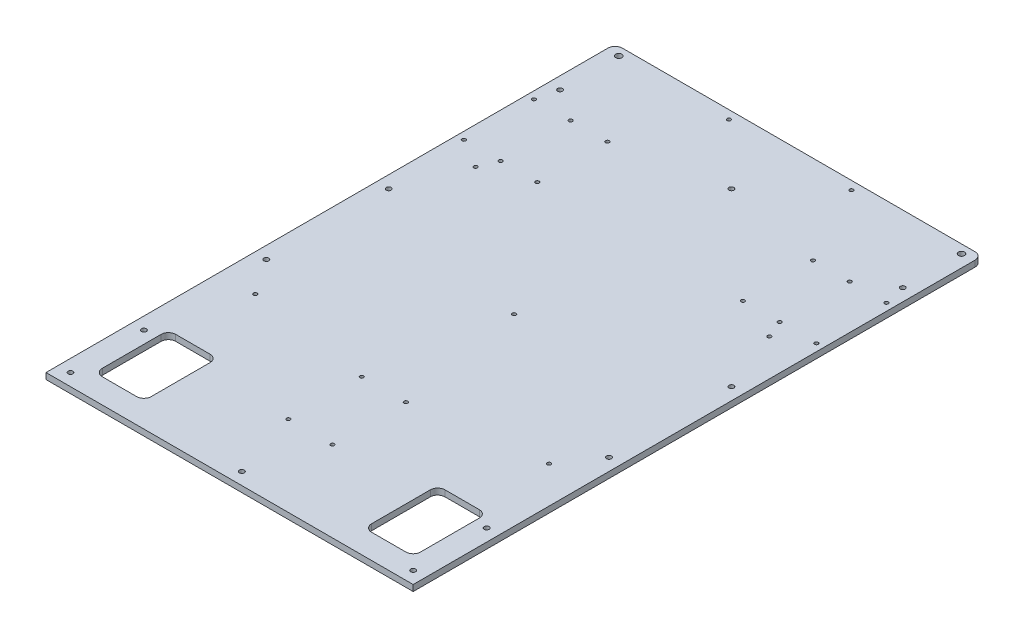
from build123d import *

# Parameters (mm, degrees)
SKETCH1_R           = 2
SKETCH1_W           = 40
SKETCH1_H           = 60
SKETCH1_R_2         = 1.5
SKETCH1_R_3         = 2.5
BOSS_EXTRUDE1_DEPTH = 5
FILLET1_R           = 6
SKETCH2_R           = 1.5
CUT_EXTRUDE1_DEPTH  = 296.88849251


with BuildPart() as part:
    # Sketch1 → Boss-Extrude1 (new body)
    with BuildSketch(Plane(origin=(0, 0, 0), x_dir=(1, 0, 0), z_dir=(0, 1, 0))):
        Polygon((-150, 210), (-150, -210), (150, -210), (150, 210), (150, 255), (-150, 255), align=None)
        with Locations((-140, -200)):
            Circle(SKETCH1_R, mode=Mode.SUBTRACT)
        with Locations((-110, -160)):
            Rectangle(SKETCH1_W, SKETCH1_H, mode=Mode.SUBTRACT)
        with Locations((-140, -140)):
            Circle(SKETCH1_R, mode=Mode.SUBTRACT)
        with Locations((-140, -40)):
            Circle(SKETCH1_R, mode=Mode.SUBTRACT)
        with Locations((0, -200)):
            Circle(SKETCH1_R, mode=Mode.SUBTRACT)
        with Locations((110, -160)):
            Rectangle(SKETCH1_W, SKETCH1_H, mode=Mode.SUBTRACT)
        with Locations((140, -200)):
            Circle(SKETCH1_R, mode=Mode.SUBTRACT)
        with Locations((140, -140)):
            Circle(SKETCH1_R, mode=Mode.SUBTRACT)
        with Locations((140, -40)):
            Circle(SKETCH1_R, mode=Mode.SUBTRACT)
        with Locations((-140, 60)):
            Circle(SKETCH1_R, mode=Mode.SUBTRACT)
        with Locations((-144, 125.375)):
            Circle(SKETCH1_R_2, mode=Mode.SUBTRACT)
        with Locations((-114, 125.375)):
            Circle(SKETCH1_R_2, mode=Mode.SUBTRACT)
        with Locations((-84, 125.375)):
            Circle(SKETCH1_R_2, mode=Mode.SUBTRACT)
        with Locations((-144, 182.625)):
            Circle(SKETCH1_R_2, mode=Mode.SUBTRACT)
        with Locations((-114, 182.625)):
            Circle(SKETCH1_R_2, mode=Mode.SUBTRACT)
        with Locations((-84, 182.625)):
            Circle(SKETCH1_R_2, mode=Mode.SUBTRACT)
        with Locations((-140, 200)):
            Circle(SKETCH1_R, mode=Mode.SUBTRACT)
        with Locations((-140, 248)):
            Circle(SKETCH1_R_3, mode=Mode.SUBTRACT)
        with Locations((-50, 248)):
            Circle(SKETCH1_R_2, mode=Mode.SUBTRACT)
        with Locations((140, 60)):
            Circle(SKETCH1_R, mode=Mode.SUBTRACT)
        with Locations((84, 125.375)):
            Circle(SKETCH1_R_2, mode=Mode.SUBTRACT)
        with Locations((114, 125.375)):
            Circle(SKETCH1_R_2, mode=Mode.SUBTRACT)
        with Locations((144, 125.375)):
            Circle(SKETCH1_R_2, mode=Mode.SUBTRACT)
        with Locations((0, 200)):
            Circle(SKETCH1_R, mode=Mode.SUBTRACT)
        with Locations((50, 248)):
            Circle(SKETCH1_R_2, mode=Mode.SUBTRACT)
        with Locations((84, 182.625)):
            Circle(SKETCH1_R_2, mode=Mode.SUBTRACT)
        with Locations((114, 182.625)):
            Circle(SKETCH1_R_2, mode=Mode.SUBTRACT)
        with Locations((144, 182.625)):
            Circle(SKETCH1_R_2, mode=Mode.SUBTRACT)
        with Locations((140, 200)):
            Circle(SKETCH1_R, mode=Mode.SUBTRACT)
        with Locations((140, 248)):
            Circle(SKETCH1_R_3, mode=Mode.SUBTRACT)
    extrude(amount=BOSS_EXTRUDE1_DEPTH)

    # Fillet1
    fillet1_edges = [part.edges().sort_by_distance(p)[0] for p in [
        (-130, 2.5, 130),
        (150, 2.5, -255),
        (-150, 2.5, -255),
        (130, 2.5, 190),
        (130, 2.5, 130),
        (90, 2.5, 130),
        (90, 2.5, 190),
        (-130, 2.5, 190),
        (-90, 2.5, 190),
        (-90, 2.5, 130),
    ]]
    fillet(fillet1_edges, radius=FILLET1_R)

    # Sketch2 → Cut-Extrude1 (cut, through all)
    with BuildSketch(Plane(origin=(0, 5, 0), x_dir=(1, 0, 0), z_dir=(0, 1, 0))):
        with Locations((-18, -144)):
            Circle(SKETCH2_R)
        with Locations((18, -144)):
            Circle(SKETCH2_R)
        with Locations((18, -84)):
            Circle(SKETCH2_R)
        with Locations((-18, -84)):
            Circle(SKETCH2_R)
        with Locations((-120, -69)):
            Circle(SKETCH2_R)
        with Locations((120, -69)):
            Circle(SKETCH2_R)
        with Locations((120, 111)):
            Circle(SKETCH2_R)
        with Locations((-120, 111)):
            Circle(SKETCH2_R)
        with Locations((0, 22.5)):
            Circle(SKETCH2_R)
    extrude(amount=-CUT_EXTRUDE1_DEPTH, mode=Mode.SUBTRACT)


solid = part.part
